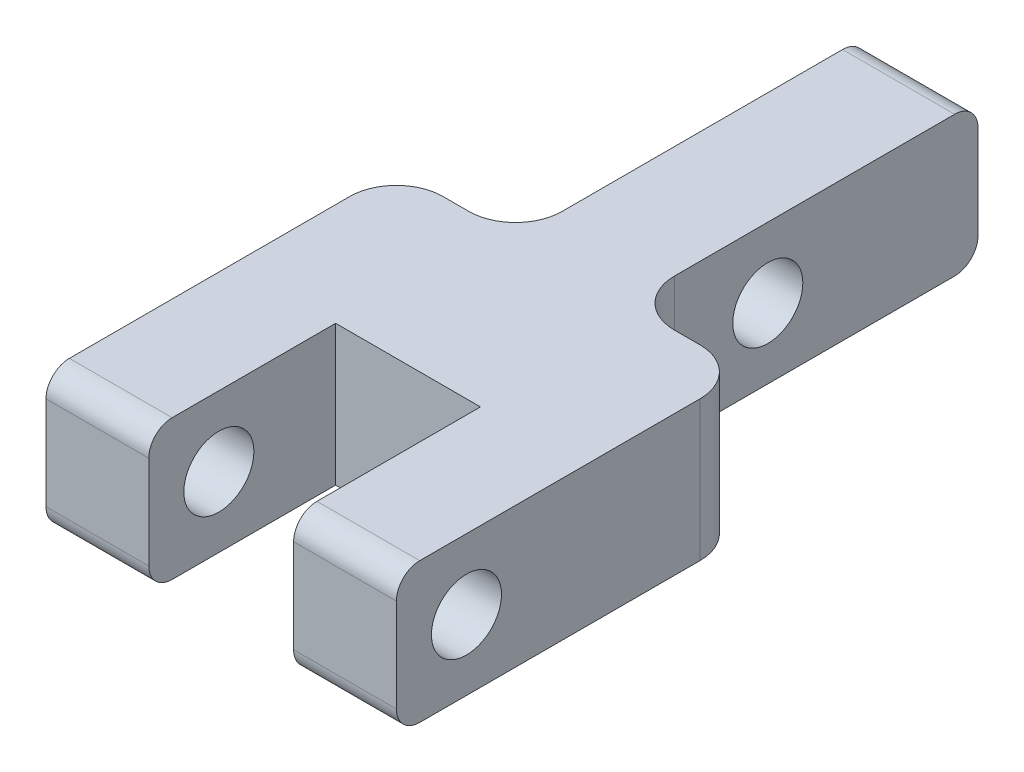
from build123d import *
from build123d.topology import SkipClean

# Parameters (mm, degrees)
SALIENTE_EXTRUIR1_DEPTH    = 2.4
CORTAR_EXTRUIR1_DEPTH      = 16.484185481
CORTAR_EXTRUIR1_DEPTH_BACK = 16.484185481
CROQUIS2_R                 = 1.5
CROQUIS3_R                 = 1.5
SALIENTE_EXTRUIR2_DEPTH    = 7.5
CORTAR_EXTRUIR2_DEPTH      = 3.1
REDONDEO1_R                = 2


with BuildPart() as part:
    # Croquis1 → Saliente-Extruir1 (new, symmetric)
    with BuildSketch(Plane(origin=(0, 0, 0), x_dir=(0, 0, -1), z_dir=(1, 0, 0))):
        with BuildLine():
            Line((-14, 3), (14, 3))
            ThreePointArc((14, 3), (14.707106781, 2.707106781), (15, 2))
            Line((15, 2), (15, -2))
            ThreePointArc((15, -2), (14.707106781, -2.707106781), (14, -3))
            Line((14, -3), (-14, -3))
            ThreePointArc((-14, -3), (-14.707106781, -2.707106781), (-15, -2))
            Line((-15, -2), (-15, 2))
            ThreePointArc((-15, 2), (-14.707106781, 2.707106781), (-14, 3))
        make_face()
    extrude(amount=SALIENTE_EXTRUIR1_DEPTH, both=True)

    # Croquis2 → Cortar-Extruir1 (cut, two sides: drawn at the far end of the back side and taken through both)
    with BuildSketch(Plane(origin=(0, 0, 0), x_dir=(0, 0, -1), z_dir=(1, 0, 0)).offset(-CORTAR_EXTRUIR1_DEPTH_BACK)):
        with Locations((-12, 0)):
            Circle(CROQUIS2_R)
        with Locations((6, 0)):
            Circle(CROQUIS2_R)
    extrude(amount=CORTAR_EXTRUIR1_DEPTH + CORTAR_EXTRUIR1_DEPTH_BACK, mode=Mode.SUBTRACT)

    # Croquis3 → Saliente-Extruir2 (add, symmetric)
    with SkipClean():  # the faces are left unmerged after this step: merging them gives an invalid solid
        with BuildSketch(Plane(origin=(0, 0, 0), x_dir=(0, 0, -1), z_dir=(1, 0, 0))):
            with BuildLine():
                Line((-15, 2), (-15, -2))
                ThreePointArc((-15, -2), (-14.707106781, -2.707106781), (-14, -3))
                Line((-14, -3), (0, -3))
                Line((0, -3), (0, 3))
                Line((0, 3), (-14, 3))
                ThreePointArc((-14, 3), (-14.707106781, 2.707106781), (-15, 2))
            make_face()
            with Locations((-12, 0)):
                Circle(CROQUIS3_R, mode=Mode.SUBTRACT)
        extrude(amount=SALIENTE_EXTRUIR2_DEPTH, both=True)
    add(part.part.scale(1), mode=Mode.REPLACE)  # the faces are merged on a copy

    # Croquis4 → Cortar-Extruir2 (cut, symmetric)
    with BuildSketch(Plane(origin=(0, 0, 0), x_dir=(0, 0, -1), z_dir=(1, 0, 0))):
        with BuildLine():
            Line((-14, 3), (-7, 3))
            Line((-7, 3), (-7, -3))
            Line((-7, -3), (-14, -3))
            ThreePointArc((-14, -3), (-14.707106781, -2.707106781), (-15, -2))
            Line((-15, -2), (-15, 2))
            ThreePointArc((-15, 2), (-14.707106781, 2.707106781), (-14, 3))
        make_face()
    extrude(amount=CORTAR_EXTRUIR2_DEPTH, both=True, mode=Mode.SUBTRACT)

    # Redondeo1
    redondeo1_edges = [part.edges().sort_by_distance(p)[0] for p in [
        (2.4, 0, 0),
        (-2.4, 0, 0),
        (7.5, 0, 0),
        (-7.5, 0, 0),
    ]]
    fillet(redondeo1_edges, radius=REDONDEO1_R)


solid = part.part
